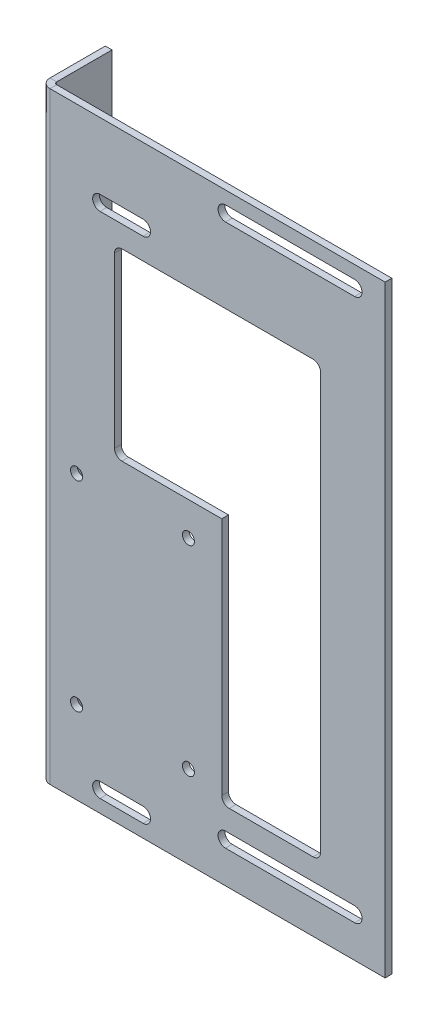
from build123d import *

# Parameters (mm, degrees)
BOSS_EXTRUDE1_DEPTH        = 88.9
FLATTEN_BENDS1_START       = -88.9
FLATTEN_BENDS1_OUTLINE_W   = 1.98374
FLATTEN_BENDS1_OUTLINE_H   = 17.06626
FLATTEN_BENDS1_DEPTH       = 177.8
FLATTEN_BENDS1_2_OUTLINE_W = 16.324394327
FLATTEN_BENDS1_2_OUTLINE_H = 1.98374
FLATTEN_BENDS1_2_DEPTH     = 177.8
PROCESS_BENDS1_START       = -88.9
PROCESS_BENDS1_DEPTH       = 177.8
PROCESS_BENDS1_2_DEPTH     = 177.8
CUT_EXTRUDE1_DEPTH         = 137.077284035
F_8_0_199_DIAMETER_HOLE1_D = 5.0546
SKETCH14_R                 = 1.778
CUT_EXTRUDE2_DEPTH         = 1.98374


# Read off the part's stored shape, not the designer's step: Flatten-Bends1, Process-Bends1
with BuildPart() as part:
    # Sketch1 → Boss-Extrude1 (new, symmetric)
    with BuildSketch(Plane(origin=(0, 0, 0), x_dir=(1, 0, 0), z_dir=(0, 1, 0))):
        Polygon((0, 0), (0, 19.05), (1.98374, 19.05), (1.98374, 1.98374), (101.6, 1.98374), (101.6, 0), align=None)
    extrude(amount=BOSS_EXTRUDE1_DEPTH, both=True)

    # Flatten-Bends1 outline → Flatten-Bends1 (cut)
    with BuildSketch(Plane(origin=(0, 0, 0), x_dir=(1, 0, 0), z_dir=(0, 1, 0)).offset(FLATTEN_BENDS1_START)):
        with Locations((0.99187, 10.51687)):
            Rectangle(FLATTEN_BENDS1_OUTLINE_W, FLATTEN_BENDS1_OUTLINE_H)
    extrude(amount=FLATTEN_BENDS1_DEPTH, mode=Mode.SUBTRACT)

    # Flatten-Bends1 2 outline → Flatten-Bends1 2 (add)
    with BuildSketch(Plane(origin=(0, 0, 0), x_dir=(1, 0, 0), z_dir=(0, 1, 0)).offset(FLATTEN_BENDS1_START)):
        with Locations((-8.162197164, 0.99187)):
            Rectangle(FLATTEN_BENDS1_2_OUTLINE_W, FLATTEN_BENDS1_2_OUTLINE_H)
    extrude(amount=FLATTEN_BENDS1_2_DEPTH)

    # Process-Bends1 outline → Process-Bends1 (cut)
    with BuildSketch(Plane(origin=(0, 0, 0), x_dir=(1, 0, 0), z_dir=(0, 1, 0)).offset(PROCESS_BENDS1_START)):
        with BuildLine():
            ThreePointArc((2.72034, 0), (1.077712947, 0.551924431), (0.101624637, 1.98374))
            Line((0.101624637, 1.98374), (-16.324394327, 1.98374))
            Line((-16.324394327, 1.98374), (-16.324394327, 0))
            Line((-16.324394327, 0), (2.72034, 0))
        make_face()
    extrude(amount=PROCESS_BENDS1_DEPTH, mode=Mode.SUBTRACT)

    # Process-Bends1 2 outline → Process-Bends1 2 (add)
    with BuildSketch(Plane(origin=(0, 0, 0), x_dir=(1, 0, 0), z_dir=(0, 1, 0)).offset(PROCESS_BENDS1_START)):
        with BuildLine():
            Line((1.98374, 2.72034), (1.98374, 19.05))
            Line((1.98374, 19.05), (0, 19.05))
            Line((0, 19.05), (0, 2.72034))
            ThreePointArc((0, 2.72034), (0.025525919, 2.348551375), (0.101624637, 1.98374))
            Line((0.101624637, 1.98374), (2.72034, 1.98374))
            ThreePointArc((2.72034, 1.98374), (2.199485145, 2.199485145), (1.98374, 2.72034))
        make_face()
    extrude(amount=PROCESS_BENDS1_2_DEPTH)

    # Sketch6 → Cut-Extrude1 (cut, through all)
    with BuildSketch(Plane(origin=(0, 0, -1.98374), x_dir=(-1, 0, 0), z_dir=(0, 0, -1))):
        with BuildLine():
            Line((-92.60000004, -74.9115748), (-54.50000004, -74.9115748))
            ThreePointArc((-54.50000004, -74.9115748), (-52.31717484, -77.0944), (-54.50000004, -79.2772252))
            Line((-54.50000004, -79.2772252), (-92.60000004, -79.2772252))
            ThreePointArc((-92.60000004, -79.2772252), (-94.78282524, -77.0944), (-92.60000004, -74.9115748))
        make_face()
        with BuildLine():
            Line((-92.60000004, 85.0884252), (-54.50000004, 85.0884252))
            ThreePointArc((-54.50000004, 85.0884252), (-52.31717484, 82.9056), (-54.50000004, 80.7227748))
            Line((-54.50000004, 80.7227748), (-92.60000004, 80.7227748))
            ThreePointArc((-92.60000004, 80.7227748), (-94.78282524, 82.9056), (-92.60000004, 85.0884252))
        make_face()
        with BuildLine():
            Line((-30.2, 69.28846), (-17.5, 69.28846))
            ThreePointArc((-17.5, 69.28846), (-15.31814, 67.1066), (-17.5, 64.92474))
            Line((-17.5, 64.92474), (-30.2, 64.92474))
            ThreePointArc((-30.2, 64.92474), (-32.38186, 67.1066), (-30.2, 69.28846))
        make_face()
        with BuildLine():
            Line((-30.2, -80.71154), (-17.5, -80.71154))
            ThreePointArc((-17.5, -80.71154), (-15.31814, -82.8934), (-17.5, -85.07526))
            Line((-17.5, -85.07526), (-30.2, -85.07526))
            ThreePointArc((-30.2, -85.07526), (-32.38186, -82.8934), (-30.2, -80.71154))
        make_face()
        with BuildLine():
            Line((-23.9531652, 4.33846), (-53.41374, 4.33846))
            Line((-53.41374, 4.33846), (-53.41374, -66.3787496))
            ThreePointArc((-53.41374, -66.3787496), (-54.053074699, -67.922240101), (-55.5965652, -68.5615748))
            Line((-55.5965652, -68.5615748), (-80.3671748, -68.5615748))
            ThreePointArc((-80.3671748, -68.5615748), (-81.910665301, -67.922240101), (-82.55, -66.3787496))
            Line((-82.55, -66.3787496), (-82.55, 56.3919148))
            ThreePointArc((-82.55, 56.3919148), (-81.910665301, 57.935405301), (-80.3671748, 58.57474))
            Line((-80.3671748, 58.57474), (-23.9531652, 58.57474))
            ThreePointArc((-23.9531652, 58.57474), (-22.409674699, 57.935405301), (-21.77034, 56.3919148))
            Line((-21.77034, 56.3919148), (-21.77034, 6.5212852))
            ThreePointArc((-21.77034, 6.5212852), (-22.409674699, 4.977794699), (-23.9531652, 4.33846))
        make_face()
    extrude(amount=-CUT_EXTRUDE1_DEPTH, mode=Mode.SUBTRACT)

    # #8 (0.199) Diameter Hole1 (through all)
    with Locations(Plane(origin=(1.98374, 0, 0), x_dir=(0, 0, -1), z_dir=(1, 0, 0))):
        with Locations((12.7, 69.85), (12.7, -76.2)):
            Hole(F_8_0_199_DIAMETER_HOLE1_D / 2)

    # Sketch14 → Cut-Extrude2 (cut)
    with BuildSketch(Plane.XY):
        with Locations((10.56374, -5.51154)):
            Circle(SKETCH14_R)
        with Locations((43.56374, -5.51154)):
            Circle(SKETCH14_R)
        with Locations((10.56374, -64.51154)):
            Circle(SKETCH14_R)
        with Locations((43.56374, -64.51154)):
            Circle(SKETCH14_R)
    extrude(amount=-CUT_EXTRUDE2_DEPTH, mode=Mode.SUBTRACT)


solid = part.part
